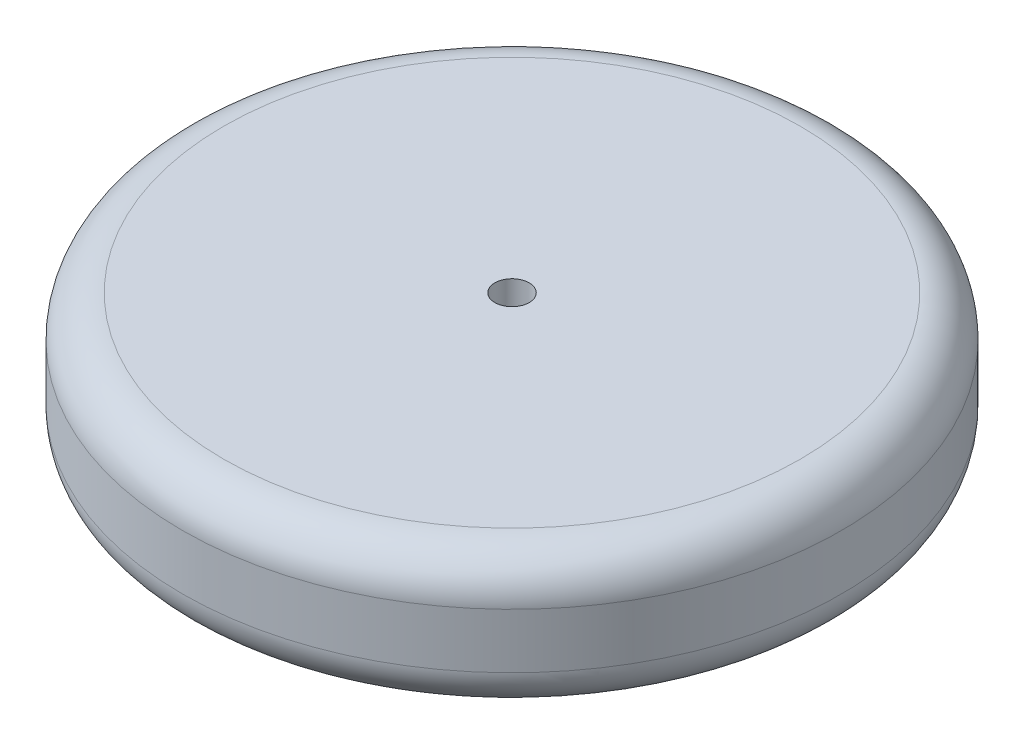
from build123d import *

# Parameters (mm, degrees)
SKETCH1_R           = 304.8
BOSS_EXTRUDE1_DEPTH = 127
FILLET1_R           = 38.1
SKETCH2_R           = 15.875
CUT_EXTRUDE1_DEPTH  = 450.371872729


with BuildPart() as part:
    # Sketch1 → Boss-Extrude1 (new body)
    with BuildSketch(Plane(origin=(0, 0, 0), x_dir=(1, 0, 0), z_dir=(0, 1, 0))):
        Circle(SKETCH1_R)
    extrude(amount=BOSS_EXTRUDE1_DEPTH)

    # Fillet1
    fillet1_edges = [part.edges().sort_by_distance(p)[0] for p in [
        (-304.8, 0, 0),
        (-304.8, 127, 0),
    ]]
    fillet(fillet1_edges, radius=FILLET1_R)

    # Sketch2 → Cut-Extrude1 (cut, through all)
    with BuildSketch(Plane(origin=(0, 127, 0), x_dir=(1, 0, 0), z_dir=(0, 1, 0))):
        Circle(SKETCH2_R)
    extrude(amount=-CUT_EXTRUDE1_DEPTH, mode=Mode.SUBTRACT)


solid = part.part
